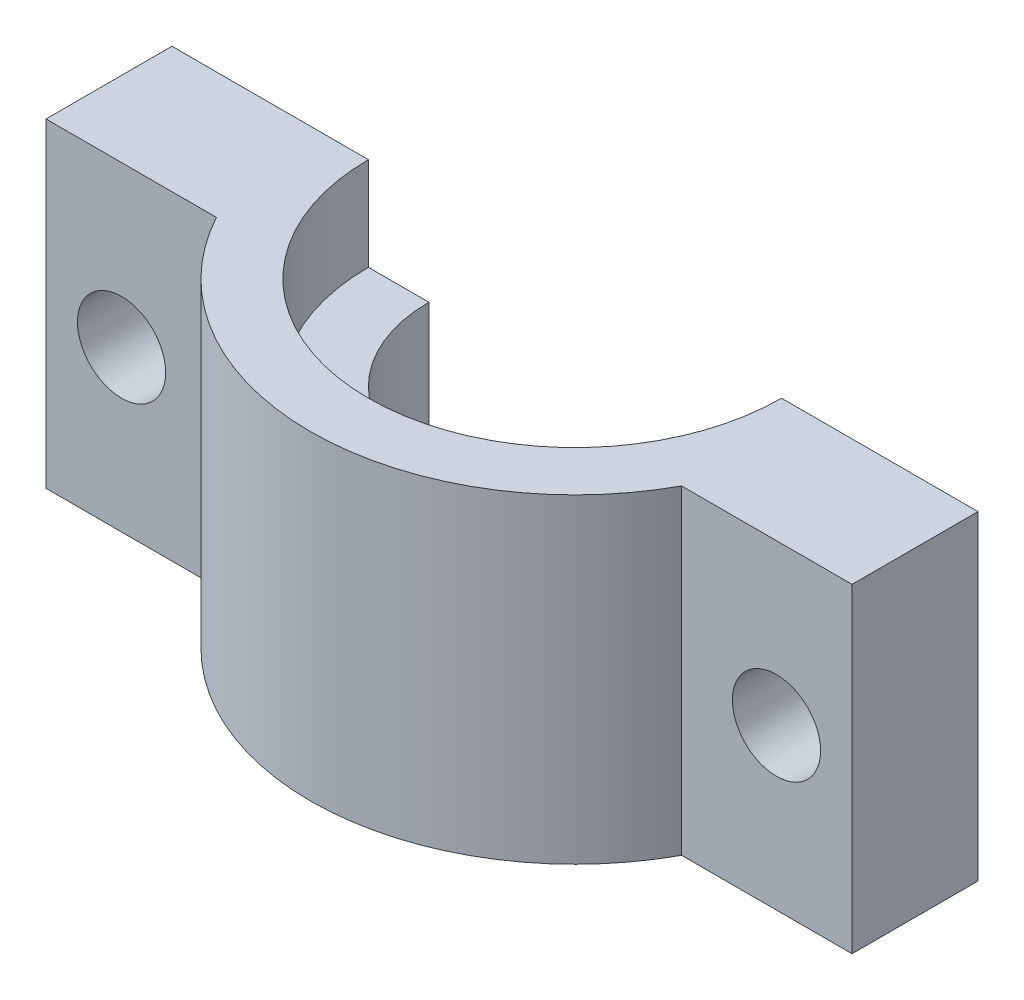
from build123d import *

# Parameters (mm, degrees)
SKETCH1_W           = 32
SKETCH1_H           = 12.7
BOSS_EXTRUDE1_DEPTH = 12
CUT_EXTRUDE1_DEPTH  = 24.691559679
SKETCH5_R           = 1.75
CUT_EXTRUDE2_DEPTH  = 19.071317052


with BuildPart() as part:
    # Sketch1 → Boss-Extrude1 (new body)
    with BuildSketch(Plane.XY):
        Rectangle(SKETCH1_W, SKETCH1_H)
    extrude(amount=BOSS_EXTRUDE1_DEPTH)

    # Sketch3 → Cut-Revolve1 (revolve, cut)
    with BuildSketch(Plane(origin=(0, 0, 0), x_dir=(0, 0, -1), z_dir=(1, 0, 0))):
        Polygon((0, 6.35), (-8.2, 6.35), (-8.2, 2.65), (-5.8, 2.65), (-5.8, -3.35), (-8.2, -3.35), (-8.2, -6.35), (0, -6.35), align=None)
    revolve(axis=Axis((0, 6.35, 0), (0, -1, 0)), mode=Mode.SUBTRACT)

    # Sketch4 → Cut-Extrude1 (cut, through all)
    with BuildSketch(Plane(origin=(0, 6.35, 0), x_dir=(1, 0, 0), z_dir=(0, 1, 0))):
        with BuildLine():
            Line((-16, -5), (-9.233092656, -5))
            ThreePointArc((-9.233092656, -5), (0, -10.5), (9.233092656, -5))
            Line((9.233092656, -5), (16, -5))
            Line((16, -5), (16, -15))
            Line((16, -15), (-16, -15))
            Line((-16, -15), (-16, -5))
        make_face()
    extrude(amount=-CUT_EXTRUDE1_DEPTH, mode=Mode.SUBTRACT)

    # Sketch5 → Cut-Extrude2 (cut, through all)
    with BuildSketch(Plane.XY.offset(5)):
        with Locations((-13, 0)):
            Circle(SKETCH5_R)
        with Locations((13, 0)):
            Circle(SKETCH5_R)
    extrude(amount=-CUT_EXTRUDE2_DEPTH, mode=Mode.SUBTRACT)


solid = part.part
